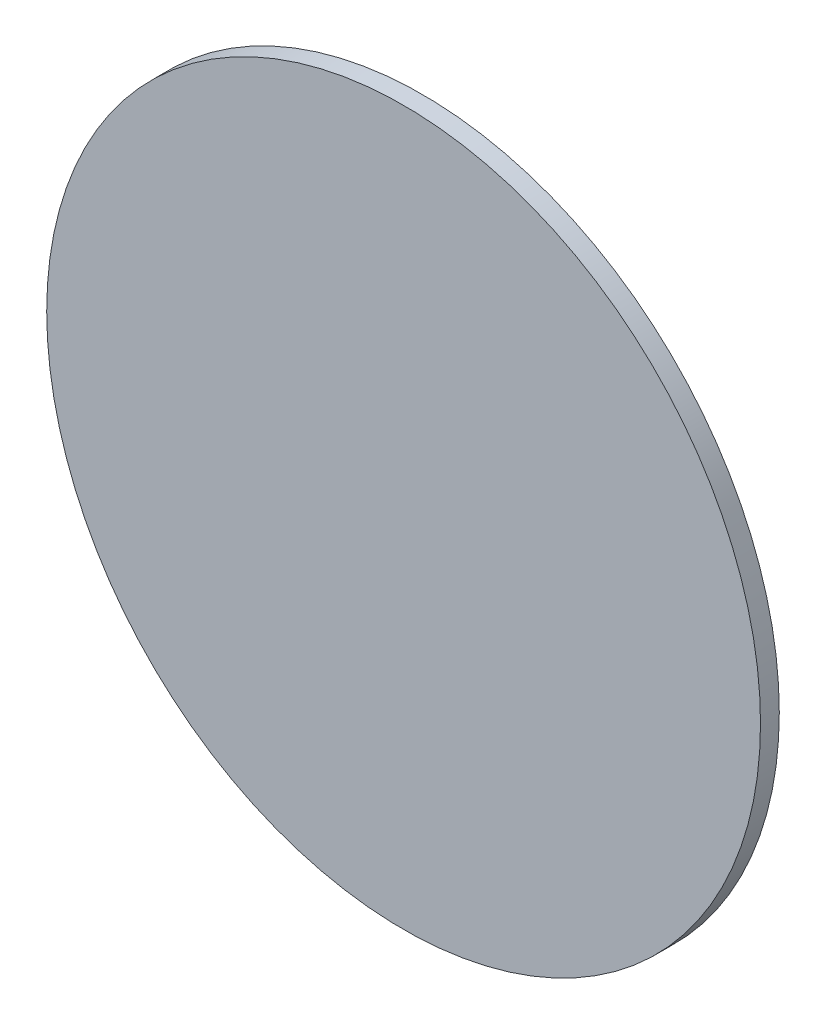
from build123d import *

# Parameters (mm, degrees)
SKETCH1_R           = 38
BOSS_EXTRUDE1_DEPTH = 2


with BuildPart() as part:
    # Sketch1 → Boss-Extrude1 (new body)
    with BuildSketch(Plane.XY):
        Circle(SKETCH1_R)
    extrude(amount=BOSS_EXTRUDE1_DEPTH)


solid = part.part
